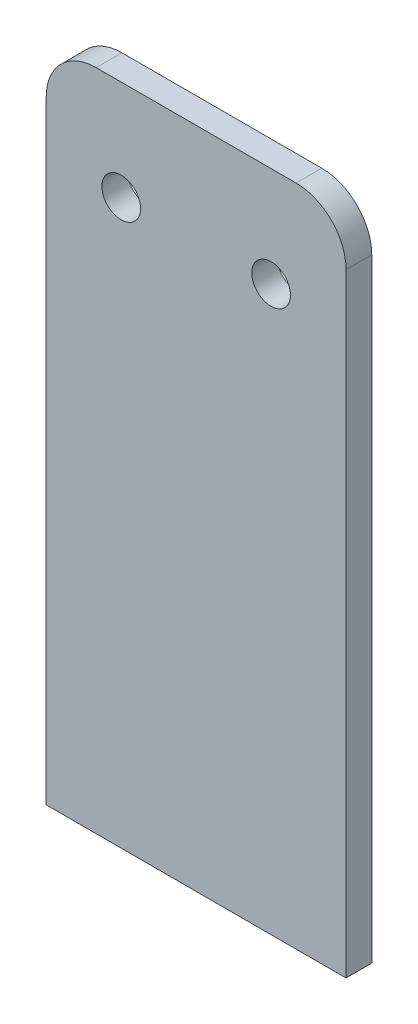
from build123d import *

# Parameters (mm, degrees)
SKETCH1_W                    = 38.1
SKETCH1_H                    = 84.30895
BASE_FLANGE1_DEPTH           = 3.2639
F_10_0_1935_DIAMETER_HOLE1_D = 4.9149
FILLET1_R                    = 6.35


# Sheet-metal steps are written as plain solids
with BuildPart() as part:
    # Sketch1 → Base-Flange1 (new body)
    with BuildSketch(Plane.XY):
        Rectangle(SKETCH1_W, SKETCH1_H)
    extrude(amount=-BASE_FLANGE1_DEPTH)

    # #10 (0.1935) Diameter Hole1 (through all)
    with Locations(Plane.XY):
        with Locations((-9.525, 29.454475), (9.525, 29.454475)):
            Hole(F_10_0_1935_DIAMETER_HOLE1_D / 2)

    # Fillet1
    fillet1_edges = [part.edges().sort_by_distance(p)[0] for p in [
        (-19.05, 42.154475, -1.63195),
        (19.05, 42.154475, -1.63195),
    ]]
    fillet(fillet1_edges, radius=FILLET1_R)


solid = part.part
